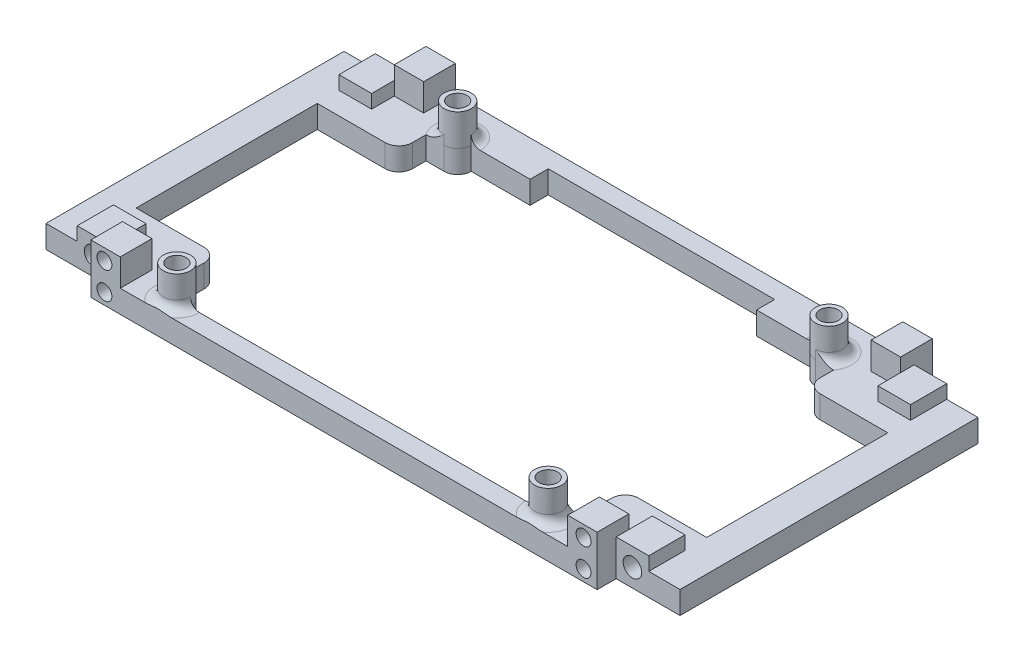
from build123d import *

# Parameters (mm, degrees)
BOSS_EXTRUDE1_DEPTH     = 5
CUT_EXTRUDE1_DEPTH      = 81.777472107
SKETCH3_R               = 3
BOSS_EXTRUDE2_DEPTH     = 7
CUT_EXTRUDE2_DEPTH      = 82.510735489
CUT_EXTRUDE2_DEPTH_BACK = 82.510735489
SKETCH4_R               = 2.05
SKETCH5_W               = 12
SKETCH5_H               = 56
CUT_EXTRUDE3_DEPTH      = 81.925892025
FILLET1_R               = 3
SKETCH6_W               = 50
SKETCH6_H               = 4
CUT_EXTRUDE4_DEPTH      = 81.925892025
SKETCH7_W               = 7.2
SKETCH7_H               = 8
BOSS_EXTRUDE3_DEPTH     = 3
SKETCH8_R               = 2.05
CUT_EXTRUDE5_DEPTH      = 6
MIRROR4_COPY_1_SKETCH_W = 7.2
MIRROR4_COPY_1_SKETCH_H = 8
MIRROR4_COPY_1_DEPTH    = 3
MIRROR4_COPY_2_SKETCH_R = 2.05
MIRROR4_COPY_2_DEPTH    = 6
SKETCH10_W              = 111.8
SKETCH10_H              = 1
CUT_EXTRUDE7_DEPTH      = 81.925892025
FILLET5_R               = 2
SKETCH11_W              = 8
SKETCH11_H              = 56
BOSS_EXTRUDE4_DEPTH     = 5
SKETCH12_W              = 18
SKETCH12_H              = 40
CUT_EXTRUDE8_DEPTH      = 81.436310209
FILLET6_R               = 3
CUT_EXTRUDE9_DEPTH      = 81.436310209
CUT_EXTRUDE9_DEPTH_BACK = 81.436310209
SKETCH13_W              = 111.8
SKETCH13_H              = 2.1
SKETCH13_H_2            = 1.9
SKETCH14_W              = 6.5
SKETCH14_H              = 7
BOSS_EXTRUDE5_DEPTH     = 6
SKETCH15_R              = 1.65
CUT_EXTRUDE10_DEPTH     = 6
CUT_EXTRUDE11_START     = -6
SKETCH16_R              = 1.65
CUT_EXTRUDE11_DEPTH     = 6


# Some blends are built 0.0001 mm under size
with BuildPart() as part:
    # Sketch1 → Boss-Extrude1 (new body)
    with BuildSketch(Plane(origin=(0, 0, 0), x_dir=(1, 0, 0), z_dir=(0, 1, 0))):
        Polygon((-70, -32.9), (-70, 32.9), (-55.9, 32.9), (-55.9, 40), (55.9, 40), (55.9, 32.9), (70, 32.9), (70, -32.9), (55.9, -32.9), (55.9, -40), (-55.9, -40), (-55.9, -32.9), align=None)
    extrude(amount=BOSS_EXTRUDE1_DEPTH)

    # Sketch2 → Cut-Extrude1 (cut, through all)
    with BuildSketch(Plane(origin=(0, 5, 0), x_dir=(1, 0, 0), z_dir=(0, 1, 0))):
        Polygon((-41, 26), (-38, 26), (-38, 29), (38, 29), (38, 26), (41, 26), (41, -30), (38, -30), (38, -33), (-38, -33), (-38, -30), (-41, -30), align=None)
    extrude(amount=-CUT_EXTRUDE1_DEPTH, mode=Mode.SUBTRACT)

    # Sketch3 → Boss-Extrude2 (add)
    with BuildSketch(Plane(origin=(0, 5, 0), x_dir=(1, 0, 0), z_dir=(0, 1, 0))):
        with Locations(Location((-41, -33, 0), (0, 0, 90))):
            Circle(SKETCH3_R)
        with Locations(Location((41, -33, 0), (0, 0, 90))):
            Circle(SKETCH3_R)
        with Locations(Location((41, 29, 0), (0, 0, 270))):
            Circle(SKETCH3_R)
        with Locations(Location((-41, 29, 0), (0, 0, 270))):
            Circle(SKETCH3_R)
    extrude(amount=BOSS_EXTRUDE2_DEPTH)

    # Sketch4 → Cut-Extrude2 (cut, two sides: drawn at the far end of the back side and taken through both)
    with BuildSketch(Plane(origin=(0, 12, 0), x_dir=(1, 0, 0), z_dir=(0, 1, 0)).offset(-CUT_EXTRUDE2_DEPTH_BACK)):
        with Locations(Location((-41, 29, 0), (0, 0, 270))):
            Circle(SKETCH4_R)
        with Locations(Location((41, 29, 0), (0, 0, 270))):
            Circle(SKETCH4_R)
        with Locations(Location((41, -33, 0), (0, 0, 270))):
            Circle(SKETCH4_R)
        with Locations(Location((-41, -33, 0), (0, 0, 270))):
            Circle(SKETCH4_R)
    extrude(amount=CUT_EXTRUDE2_DEPTH + CUT_EXTRUDE2_DEPTH_BACK, mode=Mode.SUBTRACT)

    # Sketch5 → Cut-Extrude3 (cut, through all)
    with BuildSketch(Plane(origin=(0, 5, 0), x_dir=(1, 0, 0), z_dir=(0, 1, 0))):
        with Locations((-47, -2)):
            Rectangle(SKETCH5_W, SKETCH5_H)
        with Locations((47, -2)):
            Rectangle(SKETCH5_W, SKETCH5_H)
    extrude(amount=-CUT_EXTRUDE3_DEPTH, mode=Mode.SUBTRACT)

    # Fillet1
    fillet1_edges = [part.edges().sort_by_distance(p)[0] for p in [
        (38, 2.5, 30),
        (-38, 2.5, 30),
        (38, 2.5, -26),
        (-38, 2.5, -26),
    ]]
    fillet(fillet1_edges, radius=FILLET1_R - 0.0001)  # a hair under: the kernel refuses the full size

    # Sketch6 → Cut-Extrude4 (cut, through all)
    with BuildSketch(Plane(origin=(0, 5, 0), x_dir=(1, 0, 0), z_dir=(0, 1, 0))):
        with Locations((0, 31)):
            Rectangle(SKETCH6_W, SKETCH6_H)
    extrude(amount=-CUT_EXTRUDE4_DEPTH, mode=Mode.SUBTRACT)

    # Sketch7 → Boss-Extrude3 (add)
    with BuildSketch(Plane(origin=(0, 5, 0), x_dir=(1, 0, 0), z_dir=(0, 1, 0))):
        with Locations((59.5, 28.9)):
            Rectangle(SKETCH7_W, SKETCH7_H)
    boss_extrude3 = extrude(amount=BOSS_EXTRUDE3_DEPTH)

    # Sketch8 → Cut-Extrude5 (cut)
    with BuildSketch(Plane(origin=(0, 0, -32.9), x_dir=(-1, 0, 0), z_dir=(0, 0, -1))):
        with Locations((-59.5, 4)):
            Circle(SKETCH8_R)
    cut_extrude5 = extrude(amount=-CUT_EXTRUDE5_DEPTH, mode=Mode.SUBTRACT)

    # Mirror3: Boss-Extrude3, Cut-Extrude5 across plane
    add(boss_extrude3.mirror(Plane(origin=(0, 0, 0), x_dir=(0, 0, 1), z_dir=(1, 0, 0))))
    add(cut_extrude5.mirror(Plane(origin=(0, 0, 0), x_dir=(0, 0, 1), z_dir=(1, 0, 0))), mode=Mode.SUBTRACT)

    # Mirror4: Boss-Extrude3, Cut-Extrude5 across plane
    add(boss_extrude3.mirror(Plane.XY))
    add(cut_extrude5.mirror(Plane.XY), mode=Mode.SUBTRACT)

    # Mirror4 copy 1 sketch → Mirror4 copy 1 (add)
    with BuildSketch(Plane(origin=(0, 5, 0), x_dir=(-1, 0, 0), z_dir=(0, 1, 0))):
        with Locations((59.5, 28.9)):
            Rectangle(MIRROR4_COPY_1_SKETCH_W, MIRROR4_COPY_1_SKETCH_H)
    extrude(amount=MIRROR4_COPY_1_DEPTH)

    # Mirror4 copy 2 sketch → Mirror4 copy 2 (cut)
    with BuildSketch(Plane.XY.offset(32.9)):
        with Locations((-59.5, 4)):
            Circle(MIRROR4_COPY_2_SKETCH_R)
    extrude(amount=-MIRROR4_COPY_2_DEPTH, mode=Mode.SUBTRACT)

    # Sketch10 → Cut-Extrude7 (cut, through all)
    with BuildSketch(Plane(origin=(0, 5, 0), x_dir=(1, 0, 0), z_dir=(0, 1, 0))):
        with Locations((0, 39.5)):
            Rectangle(SKETCH10_W, SKETCH10_H)
        with Locations((0, -39.5)):
            Rectangle(SKETCH10_W, SKETCH10_H)
    extrude(amount=-CUT_EXTRUDE7_DEPTH, mode=Mode.SUBTRACT)

    # Fillet5
    # the kernel refuses this fillet: 2 mm, written as the material it adds along each edge
    with BuildSketch(Plane(origin=(41, 5, 33), x_dir=(-1, 0, 0), z_dir=(0, 0, -1))) as fillet5_piece_1_section:
        with BuildLine():
            CenterArc((3 + FILLET5_R, FILLET5_R), FILLET5_R, 180, 90)
            Line((3, FILLET5_R), (3, 0))
            Line((3, 0), (3 + FILLET5_R, 0))
        make_face()
    fillet5_piece_1 = revolve(axis=Axis((41, 5, 33), (0, 1, 0)), revolution_arc=270, mode=Mode.PRIVATE)
    fillet5_piece_1 = split(fillet5_piece_1, bisect_by=Plane(origin=(37.573130255, 5.322558535, 30), z_dir=(0, 0, 1)), keep=Keep.TOP, mode=Mode.PRIVATE)
    add(fillet5_piece_1)
    with BuildSketch(Plane(origin=(-41, 5, 33), x_dir=(0, 0, -1), z_dir=(1, 0, 0))) as fillet5_piece_2_section:
        with BuildLine():
            CenterArc((3 + FILLET5_R, FILLET5_R), FILLET5_R, 180, 90)
            Line((3, FILLET5_R), (3, 0))
            Line((3, 0), (3 + FILLET5_R, 0))
        make_face()
    fillet5_piece_2 = revolve(axis=Axis((-41, 5, 33), (0, 1, 0)), revolution_arc=270, mode=Mode.PRIVATE)
    fillet5_piece_2 = split(fillet5_piece_2, bisect_by=Plane(origin=(-43.742596375, 5.466410384, 30), z_dir=(0, 0, 1)), keep=Keep.TOP, mode=Mode.PRIVATE)
    add(fillet5_piece_2)
    with BuildSketch(Plane(origin=(41, 5, -29), x_dir=(0, 0, 1), z_dir=(-1, 0, 0))) as fillet5_piece_3_section:
        with BuildLine():
            CenterArc((3 + FILLET5_R, FILLET5_R), FILLET5_R, 180, 90)
            Line((3, FILLET5_R), (3, 0))
            Line((3, 0), (3 + FILLET5_R, 0))
        make_face()
    fillet5_piece_3 = revolve(axis=Axis((41, 5, -29), (0, 1, 0)), revolution_arc=270, mode=Mode.PRIVATE)
    fillet5_piece_3 = split(fillet5_piece_3, bisect_by=Plane(origin=(43.742596375, 5.466410384, -26), z_dir=(0, 0, -1)), keep=Keep.TOP, mode=Mode.PRIVATE)
    add(fillet5_piece_3)
    with BuildSketch(Plane(origin=(-41, 5, -29), x_dir=(1, 0, 0), z_dir=(0, 0, 1))) as fillet5_piece_4_section:
        with BuildLine():
            CenterArc((3 + FILLET5_R, FILLET5_R), FILLET5_R, 180, 90)
            Line((3 + FILLET5_R, 0), (3, 0))
            Line((3, 0), (3, FILLET5_R))
        make_face()
    fillet5_piece_4 = revolve(axis=Axis((-41, 5, -29), (0, 1, 0)), revolution_arc=270, mode=Mode.PRIVATE)
    fillet5_piece_4 = split(fillet5_piece_4, bisect_by=Plane(origin=(-41, 5.571713042, -26), z_dir=(0, 0, -1)), keep=Keep.TOP, mode=Mode.PRIVATE)
    add(fillet5_piece_4)

    # Sketch11 → Boss-Extrude4 (add)
    with BuildSketch(Plane(origin=(0, 5, 0), x_dir=(1, 0, 0), z_dir=(0, 1, 0))):
        with Locations((49, -2)):
            Rectangle(SKETCH11_W, SKETCH11_H)
        with Locations((-49, -2)):
            Rectangle(SKETCH11_W, SKETCH11_H)
    extrude(amount=-BOSS_EXTRUDE4_DEPTH)

    # Sketch12 → Cut-Extrude8 (cut, symmetric)
    with BuildSketch(Plane(origin=(0, 5, 0), x_dir=(1, 0, 0), z_dir=(0, 1, 0))):
        with Locations((54, 0)):
            Rectangle(SKETCH12_W, SKETCH12_H)
    cut_extrude8 = extrude(amount=CUT_EXTRUDE8_DEPTH, both=True, mode=Mode.SUBTRACT)

    # Mirror7: Cut-Extrude8 across plane
    add(cut_extrude8.mirror(Plane(origin=(0, 0, 0), x_dir=(0, 0, 1), z_dir=(1, 0, 0))), mode=Mode.SUBTRACT)

    # Fillet6
    fillet6_edges = [part.edges().sort_by_distance(p)[0] for p in [
        (45, 2.5, 20),
        (45, 2.5, -20),
        (-45, 2.5, -20),
        (-45, 2.5, 20),
    ]]
    fillet(fillet6_edges, radius=FILLET6_R)

    # Sketch13 → Cut-Extrude9 (cut, two sides: drawn at the far end of the back side and taken through both)
    with BuildSketch(Plane(origin=(0, 5, 0), x_dir=(1, 0, 0), z_dir=(0, 1, 0)).offset(-CUT_EXTRUDE9_DEPTH_BACK)):
        with Locations((0, 37.95)):
            Rectangle(SKETCH13_W, SKETCH13_H)
        with Locations((0, -38.05)):
            Rectangle(SKETCH13_W, SKETCH13_H_2)
    extrude(amount=CUT_EXTRUDE9_DEPTH + CUT_EXTRUDE9_DEPTH_BACK, mode=Mode.SUBTRACT)

    # Sketch14 → Boss-Extrude5 (add)
    with BuildSketch(Plane(origin=(0, 5, 0), x_dir=(1, 0, 0), z_dir=(0, 1, 0))):
        with Locations((-52.65, -33.6)):
            Rectangle(SKETCH14_W, SKETCH14_H)
        with Locations((-52.65, 33.4)):
            Rectangle(SKETCH14_W, SKETCH14_H)
    boss_extrude5 = extrude(amount=BOSS_EXTRUDE5_DEPTH)

    # Sketch15 → Cut-Extrude10 (cut)
    with BuildSketch(Plane.XY.offset(37.1)):
        with Locations((-52.9, 2.5)):
            Circle(SKETCH15_R)
        with Locations((-52.9, 8.5)):
            Circle(SKETCH15_R)
    cut_extrude10 = extrude(amount=-CUT_EXTRUDE10_DEPTH, mode=Mode.SUBTRACT)

    # Sketch16 → Cut-Extrude11 (cut)
    with BuildSketch(Plane(origin=(0, 0, -36.9), x_dir=(-1, 0, 0), z_dir=(0, 0, -1)).offset(CUT_EXTRUDE11_START)):
        with Locations(Location((52.9, 8.5, 0), (0, 0, 180))):
            Circle(SKETCH16_R)
        with Locations(Location((52.9, 2.5, 0), (0, 0, 180))):
            Circle(SKETCH16_R)
    cut_extrude11 = extrude(amount=CUT_EXTRUDE11_DEPTH, mode=Mode.SUBTRACT)

    # Mirror8: Boss-Extrude5, Cut-Extrude10, Cut-Extrude11 across plane
    add(boss_extrude5.mirror(Plane(origin=(0, 0, 0), x_dir=(0, 0, 1), z_dir=(1, 0, 0))))
    add(cut_extrude10.mirror(Plane(origin=(0, 0, 0), x_dir=(0, 0, 1), z_dir=(1, 0, 0))), mode=Mode.SUBTRACT)
    add(cut_extrude11.mirror(Plane(origin=(0, 0, 0), x_dir=(0, 0, 1), z_dir=(1, 0, 0))), mode=Mode.SUBTRACT)


solid = part.part
